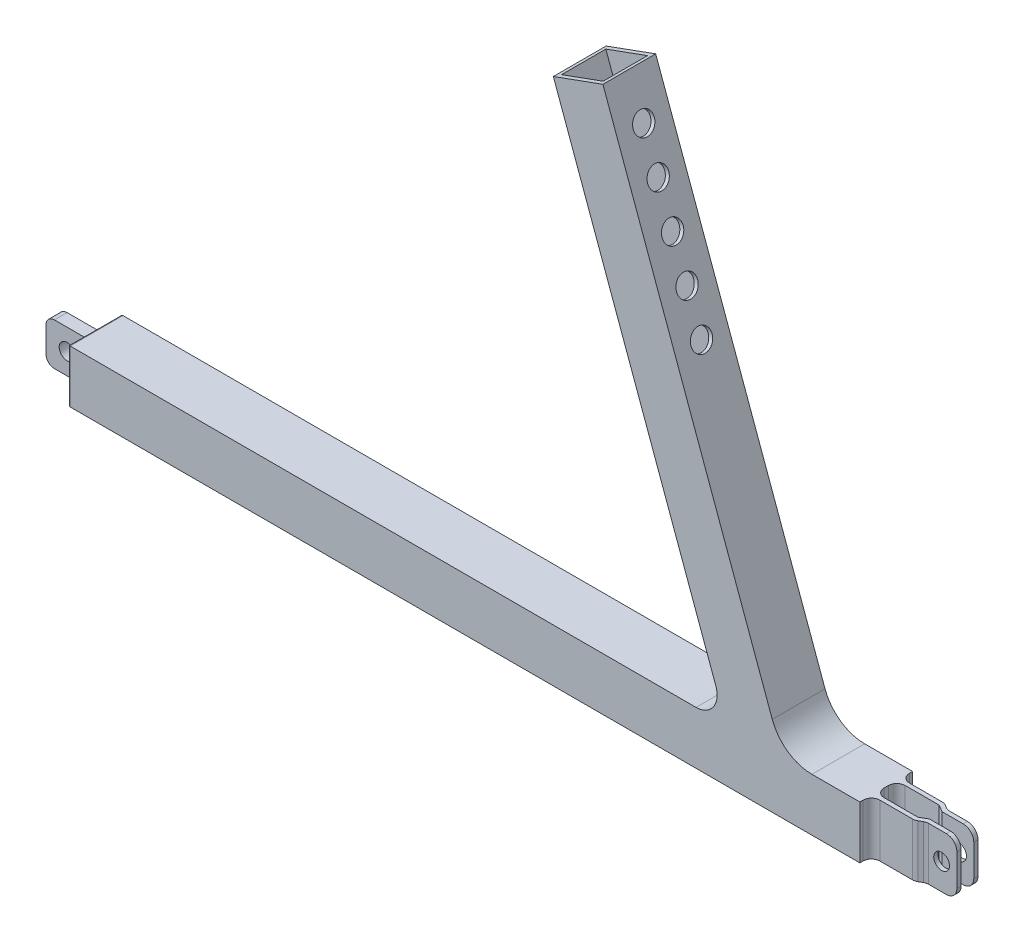
from build123d import *

# Parameters (mm, degrees)
SKETCH1_W                = 25
SKETCH1_H                = 25
SKETCH1_W_2              = 21
SKETCH1_H_2              = 21
BOSS_EXTRUDE1_DEPTH      = 375
SKETCH2_W                = 25
SKETCH2_H                = 25
BOSS_EXTRUDE2_DEPTH      = 2
SKETCH3_W                = 20
SKETCH3_H                = 20
SKETCH3_R                = 3.75
BOSS_EXTRUDE3_DEPTH      = 3
FILLET1_R                = 1
FILLET2_R                = 4
BOSS_EXTRUDE4_DEPTH      = 12.5
BOSS_EXTRUDE4_DEPTH_BACK = 12.5
CUT_EXTRUDE1_REACH       = 451.804
SKETCH5_W                = 21
SKETCH5_H                = 21
FILLET3_R                = 20
FILLET4_R                = 10
SKETCH6_W                = 25
SKETCH6_H                = 25
BOSS_EXTRUDE5_DEPTH      = 2
THICKEN1_START           = -12.5
THICKEN1_DEPTH           = 25
THICKEN2_START           = -12.5
THICKEN2_DEPTH           = 25
CUT_EXTRUDE2_DEPTH       = 482.455775371
CUT_EXTRUDE2_DEPTH_BACK  = 482.455775371
SKETCH9_R                = 3.75
FILLET6_R                = 4
FILLET7_R                = 5
CUT_EXTRUDE3_DEPTH       = 351.398422086
CUT_EXTRUDE3_DEPTH_BACK  = 351.398422086
SKETCH10_R               = 5


# Read off the part's stored shape, not the designer's step: Thicken1, Thicken2
with BuildPart() as part:
    # Sketch1 → Boss-Extrude1 (new body)
    with BuildSketch(Plane(origin=(0, 0, 0), x_dir=(0, 0, -1), z_dir=(1, 0, 0))):
        Rectangle(SKETCH1_W, SKETCH1_H)
        Rectangle(SKETCH1_W_2, SKETCH1_H_2, mode=Mode.SUBTRACT)
    extrude(amount=BOSS_EXTRUDE1_DEPTH)

    # Sketch2 → Boss-Extrude2 (add)
    with BuildSketch(Plane.ZY):
        Rectangle(SKETCH2_W, SKETCH2_H)
    extrude(amount=-BOSS_EXTRUDE2_DEPTH)

    # Sketch3 → Boss-Extrude3 (add, symmetric)
    with BuildSketch(Plane.XY):
        with Locations((-10, 0)):
            Rectangle(SKETCH3_W, SKETCH3_H)
        with Locations((-10, 0)):
            Circle(SKETCH3_R, mode=Mode.SUBTRACT)
    extrude(amount=BOSS_EXTRUDE3_DEPTH, both=True)

    # Fillet1
    fillet1_edges = [part.edges().sort_by_distance(p)[0] for p in [
        (0, 12.5, 0),
        (0, 0, -12.5),
        (0, 0, 3),
        (0, 0, -3),
        (0, -10, 0),
        (0, 10, 0),
        (0, -12.5, 0),
        (0, 0, 12.5),
    ]]
    fillet(fillet1_edges, radius=FILLET1_R)

    # Fillet2
    fillet2_edges = [part.edges().sort_by_distance(p)[0] for p in [
        (-20, 10, 0),
        (-20, -10, 0),
    ]]
    fillet(fillet2_edges, radius=FILLET2_R)

    # Sketch4 → Boss-Extrude4 (add, two sides: drawn at the far end of the back side and taken through both)
    with BuildSketch(Plane.XY.offset(-BOSS_EXTRUDE4_DEPTH_BACK)):
        Polygon((338.302222156, 12.5), (253.296790654, 246.050503583), (229.804475134, 237.5), (311.697777844, 12.5), align=None)
    extrude(amount=BOSS_EXTRUDE4_DEPTH + BOSS_EXTRUDE4_DEPTH_BACK)

    # Cut-Extrude1: up to this plane
    cut_extrude1_end = Plane(origin=(375, 10.5, -10.5), z_dir=(0, -1, 0))
    # Sketch5 → Cut-Extrude1 (cut, up to the surface)
    with BuildSketch(Plane(origin=(-49.449011673, 135.860042987, 0), x_dir=(0, 0, 1), z_dir=(-0.3420201433256653, 0.9396926207859098, 0)), mode=Mode.PRIVATE) as cut_extrude1_sk1:
        with Locations((0, 309.675353547)):
            Rectangle(SKETCH5_W, SKETCH5_H)
    cut_extrude1_tool1 = split(extrude(cut_extrude1_sk1.sketch, amount=-CUT_EXTRUDE1_REACH, mode=Mode.PRIVATE), bisect_by=cut_extrude1_end, keep=Keep.BOTH, mode=Mode.PRIVATE)
    add(cut_extrude1_tool1.solids().sort_by_distance((241.550633, 241.775252, 0))[0], mode=Mode.SUBTRACT)

    # Fillet3
    fillet3_edges = [part.edges().sort_by_distance(p)[0] for p in [
        (338.302222156, 12.5, 0),
    ]]
    fillet(fillet3_edges, radius=FILLET3_R)

    # Fillet4
    fillet4_edges = [part.edges().sort_by_distance(p)[0] for p in [
        (311.697777844, 12.5, 0),
    ]]
    fillet(fillet4_edges, radius=FILLET4_R)

    # Sketch6 → Boss-Extrude5 (add)
    with BuildSketch(Plane(origin=(375, 0, 0), x_dir=(0, 0, -1), z_dir=(1, 0, 0))):
        Rectangle(SKETCH6_W, SKETCH6_H)
    extrude(amount=-BOSS_EXTRUDE5_DEPTH)

    # Thicken1 outline → Thicken1 (add)
    with BuildSketch(Plane(origin=(0, 0, 0), x_dir=(1, 0, 0), z_dir=(0, 1, 0)).offset(THICKEN1_START)):
        Polygon((398.464101615, 3), (413.464101615, 3), (413.464101615, 5), (399, 5), (395.535898385, 7), (375, 7), (375, 5), (395, 5), align=None)
    extrude(amount=THICKEN1_DEPTH)

    # Thicken2 outline → Thicken2 (add)
    with BuildSketch(Plane(origin=(0, 0, 0), x_dir=(1, 0, 0), z_dir=(0, 1, 0)).offset(THICKEN2_START)):
        Polygon((399, -5), (413.464101615, -5), (413.464101615, -3), (398.464101615, -3), (395, -5), (375, -5), (375, -7), (395.535898385, -7), align=None)
    extrude(amount=THICKEN2_DEPTH)

    # Sketch9 → Cut-Extrude2 (cut, two sides: drawn at the far end of the back side and taken through both)
    with BuildSketch(Plane.XY.offset(5).offset(-CUT_EXTRUDE2_DEPTH_BACK)):
        with Locations(Location((406.232050808, 0, 0), (0, 0, 90))):
            Circle(SKETCH9_R)
    extrude(amount=CUT_EXTRUDE2_DEPTH + CUT_EXTRUDE2_DEPTH_BACK, mode=Mode.SUBTRACT)

    # Fillet6
    fillet6_edges = [part.edges().sort_by_distance(p)[0] for p in [
        (375, 0, -7),
        (395.535898385, 0, -7),
        (399, 0, -5),
        (375, 0, -5),
        (375, 0, 5),
        (375, 0, 7),
        (395.535898385, 0, 7),
        (399, 0, 5),
    ]]
    fillet(fillet6_edges, radius=FILLET6_R)

    # Fillet7
    fillet7_edges = [part.edges().sort_by_distance(p)[0] for p in [
        (413.464101615, 12.5, -4),
        (413.464101615, -12.5, -4),
        (413.464101615, 12.5, 4),
        (413.464101615, -12.5, 4),
    ]]
    fillet(fillet7_edges, radius=FILLET7_R)

    # Sketch10 → Cut-Extrude3 (cut, two sides: drawn at the far end of the back side and taken through both)
    with BuildSketch(Plane(origin=(302.745802327, 110.190460596, 0), x_dir=(0, 0, -1), z_dir=(0.9396926207859093, 0.34202014332566627, 0)).offset(-CUT_EXTRUDE3_DEPTH_BACK)):
        with Locations(Location((0, 124.579237914, 0), (0, 0, 90))):
            Circle(SKETCH10_R)
        with Locations(Location((0, 104.579237914, 0), (0, 0, 90))):
            Circle(SKETCH10_R)
        with Locations(Location((0, 84.579237914, 0), (0, 0, 90))):
            Circle(SKETCH10_R)
        with Locations(Location((0, 64.579237914, 0), (0, 0, 90))):
            Circle(SKETCH10_R)
        with Locations(Location((0, 44.579237914, 0), (0, 0, 90))):
            Circle(SKETCH10_R)
    extrude(amount=CUT_EXTRUDE3_DEPTH + CUT_EXTRUDE3_DEPTH_BACK, mode=Mode.SUBTRACT)


solid = part.part
